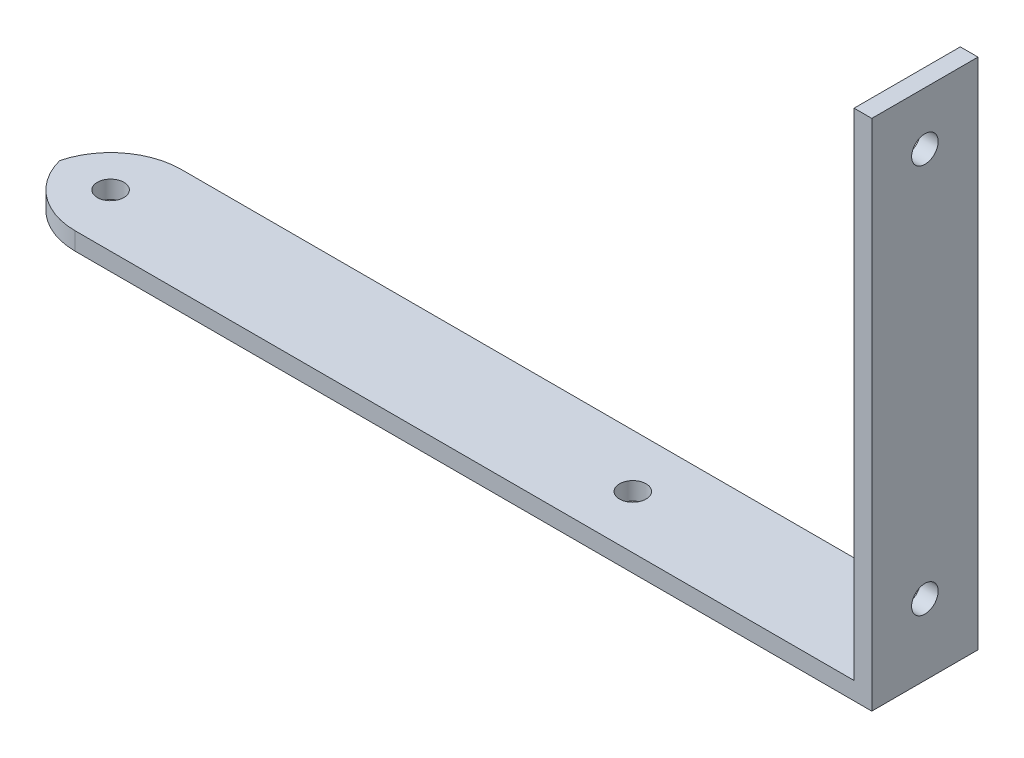
from build123d import *

# Parameters (mm, degrees)
SKETCH1_W           = 98
SKETCH1_H           = 12
BOSS_EXTRUDE1_DEPTH = 2
SKETCH2_W           = 2
SKETCH2_H           = 12
BOSS_EXTRUDE2_DEPTH = 56
SKETCH3_R           = 1.5
CUT_EXTRUDE1_DEPTH  = 114.507708989
FILLET1_R           = 8
SKETCH4_R           = 1.5
CUT_EXTRUDE2_DEPTH  = 113.584591032


with BuildPart() as part:
    # Sketch1 → Boss-Extrude1 (new body)
    with BuildSketch(Plane(origin=(0, 0, 0), x_dir=(1, 0, 0), z_dir=(0, 1, 0))):
        with Locations((49, 6)):
            Rectangle(SKETCH1_W, SKETCH1_H)
    extrude(amount=BOSS_EXTRUDE1_DEPTH)

    # Sketch2 → Boss-Extrude2 (add)
    with BuildSketch(Plane(origin=(0, 2, 0), x_dir=(1, 0, 0), z_dir=(0, 1, 0))):
        with Locations((97, 6)):
            Rectangle(SKETCH2_W, SKETCH2_H)
    extrude(amount=BOSS_EXTRUDE2_DEPTH)

    # Sketch3 → Cut-Extrude1 (cut, through all)
    with BuildSketch(Plane(origin=(0, 2, 0), x_dir=(1, 0, 0), z_dir=(0, 1, 0))):
        with Locations(Location((6, 6, 0), (0, 0, 270))):
            Circle(SKETCH3_R)
        with Locations(Location((65, 6, 0), (0, 0, 270))):
            Circle(SKETCH3_R)
    extrude(amount=-CUT_EXTRUDE1_DEPTH, mode=Mode.SUBTRACT)

    # Fillet1
    # the kernel refuses this fillet: 8 mm, written as the material it takes off along each edge
    with BuildSketch(Plane(origin=(0, -20, 0), x_dir=(1, 0, 0), z_dir=(0, 1, 0)), Plane(origin=(0, -20, -12), x_dir=(0, 0, 1), z_dir=(0, 1, 0))) as fillet1_piece_1:
        with BuildLine():
            CenterArc((FILLET1_R, FILLET1_R), FILLET1_R, 180, 90)
            Line((0, FILLET1_R), (0, 0))
            Line((0, 0), (FILLET1_R, 0))
        make_face()
    extrude(amount=42, mode=Mode.SUBTRACT)

    # Sketch4 → Cut-Extrude2 (cut, through all)
    with BuildSketch(Plane.ZY.offset(-96)):
        with Locations((-6, 8)):
            Circle(SKETCH4_R)
        with Locations((-6, 52)):
            Circle(SKETCH4_R)
    extrude(amount=-CUT_EXTRUDE2_DEPTH, mode=Mode.SUBTRACT)


solid = part.part
